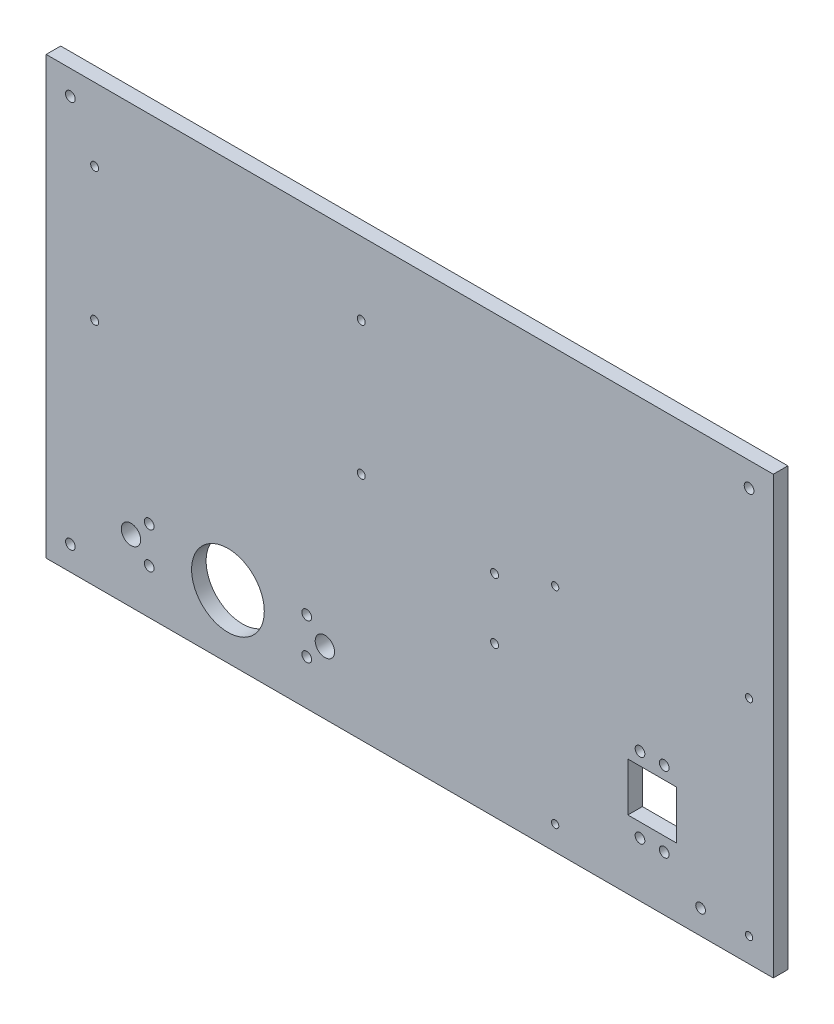
from build123d import *

# Parameters (mm, degrees)
ESBO_O1_W                = 300
ESBO_O1_H                = 180
ESBO_O1_R                = 2
ESBO_O1_R_2              = 4
ESBO_O1_R_3              = 15
ESBO_O1_R_4              = 1.5
ESBO_O1_W_2              = 20
ESBO_O1_H_2              = 20
ESBO_O1_R_5              = 1.65
RESSALTO_EXTRUS_O1_DEPTH = 6
ESBO_O2_R                = 2
CORTE_EXTRUS_O1_DEPTH    = 10
ESBO_O3_R                = 2
CORTE_EXTRUS_O2_DEPTH    = 10


with BuildPart() as part:
    # Esboço1 → Ressalto-extrusão1 (new body)
    with BuildSketch(Plane.XY):
        Rectangle(ESBO_O1_W, ESBO_O1_H)
        with Locations((-107.5, -71.5)):
            Circle(ESBO_O1_R, mode=Mode.SUBTRACT)
        with Locations((-115, -64)):
            Circle(ESBO_O1_R_2, mode=Mode.SUBTRACT)
        with Locations((-107.5, -56.5)):
            Circle(ESBO_O1_R, mode=Mode.SUBTRACT)
        with Locations((-42.5, -71.5)):
            Circle(ESBO_O1_R, mode=Mode.SUBTRACT)
        with Locations((-75, -64)):
            Circle(ESBO_O1_R_3, mode=Mode.SUBTRACT)
        with Locations((-42.5, -56.5)):
            Circle(ESBO_O1_R, mode=Mode.SUBTRACT)
        with Locations((-35, -64)):
            Circle(ESBO_O1_R_2, mode=Mode.SUBTRACT)
        with Locations((60, -80)):
            Circle(ESBO_O1_R_4, mode=Mode.SUBTRACT)
        with Locations((140, -80)):
            Circle(ESBO_O1_R_4, mode=Mode.SUBTRACT)
        with Locations((100, -51.75)):
            Rectangle(ESBO_O1_W_2, ESBO_O1_H_2, mode=Mode.SUBTRACT)
        with Locations((35, -28)):
            Circle(ESBO_O1_R_5, mode=Mode.SUBTRACT)
        with Locations((35, -3)):
            Circle(ESBO_O1_R_5, mode=Mode.SUBTRACT)
        with Locations((-130, 5)):
            Circle(ESBO_O1_R_5, mode=Mode.SUBTRACT)
        with Locations((-20, 5)):
            Circle(ESBO_O1_R_5, mode=Mode.SUBTRACT)
        with Locations((-130, 60)):
            Circle(ESBO_O1_R_5, mode=Mode.SUBTRACT)
        with Locations((-20, 60)):
            Circle(ESBO_O1_R_5, mode=Mode.SUBTRACT)
        with Locations((60, 5)):
            Circle(ESBO_O1_R_4, mode=Mode.SUBTRACT)
        with Locations((140, 5)):
            Circle(ESBO_O1_R_4, mode=Mode.SUBTRACT)
    extrude(amount=RESSALTO_EXTRUS_O1_DEPTH)

    # Esboço2 → Corte-extrusão1 (cut)
    with BuildSketch(Plane.XY.offset(6)):
        with Locations((120, -80)):
            Circle(ESBO_O2_R)
        with Locations((140, 80)):
            Circle(ESBO_O2_R)
        with Locations((-140, 80)):
            Circle(ESBO_O2_R)
        with Locations((-140, -80)):
            Circle(ESBO_O2_R)
    extrude(amount=-CORTE_EXTRUS_O1_DEPTH, mode=Mode.SUBTRACT)

    # Esboço3 → Corte-extrusão2 (cut)
    with BuildSketch(Plane.XY.offset(6)):
        with Locations((105, -67.5)):
            Circle(ESBO_O3_R)
        with Locations((105, -36.5)):
            Circle(ESBO_O3_R)
        with Locations((95, -36.5)):
            Circle(ESBO_O3_R)
        with Locations((95, -67.5)):
            Circle(ESBO_O3_R)
    extrude(amount=-CORTE_EXTRUS_O2_DEPTH, mode=Mode.SUBTRACT)


solid = part.part
